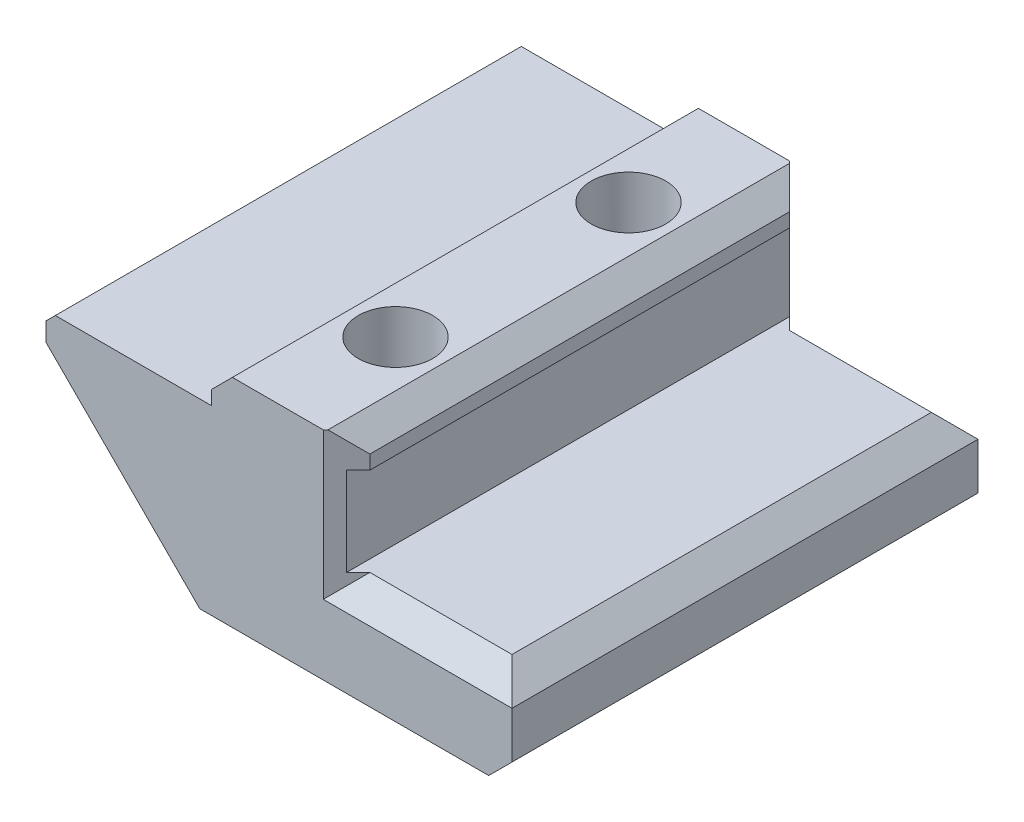
from build123d import *

# Parameters (mm, degrees)
SKETCH_1_W          = 20
SKETCH_1_H          = 20
EXTRUDE_1_DEPTH     = 4
SKETCH_2_W          = 12.9
SKETCH_2_H          = 20
EXTRUDE_2_DEPTH     = 3.8
SKETCH_3_R          = 1.6
CUT_EXTRUDE_1_DEPTH = 30.340074983
SKETCH_4_W          = 5.8
SKETCH_4_H          = 20
SKETCH_4_R          = 1.6
EXTRUDE_3_DEPTH     = 1.5
SKETCH_5_R          = 3
CUT_EXTRUDE_3_DEPTH = 2.4
CHAMFER_3_SIZE      = 1.5
CHAMFER_1_SIZE      = 6.6
CHAMFER_2_SIZE      = 1
CHAMFER_4_SIZE      = 0.4
CHAMFER_5_SIZE      = 0.9
SKETCH_7_W          = 21.061561739
SKETCH_7_H          = 3.8
CUT_EXTRUDE_6_DEPTH = 0.5


with BuildPart() as part:
    # 草图1 → 凸台-拉伸1 (new body)
    with BuildSketch(Plane(origin=(0, 0, 0), x_dir=(1, 0, 0), z_dir=(0, 1, 0))):
        with Locations((10, 10)):
            Rectangle(SKETCH_1_W, SKETCH_1_H)
    extrude(amount=EXTRUDE_1_DEPTH)

    # 草图2 → 凸台-拉伸2 (add)
    with BuildSketch(Plane(origin=(0, 4, 0), x_dir=(1, 0, 0), z_dir=(0, 1, 0))):
        with Locations((6.45, 10)):
            Rectangle(SKETCH_2_W, SKETCH_2_H)
    extrude(amount=EXTRUDE_2_DEPTH)

    # 草图3 → 切除-拉伸1 (cut, through all)
    with BuildSketch(Plane(origin=(0, 0, 0), x_dir=(-1, 0, 0), z_dir=(0, -1, 0))):
        with Locations(Location((-10, 5, 0), (0, 0, 90))):
            Circle(SKETCH_3_R)
        with Locations(Location((-10, 15, 0), (0, 0, 90))):
            Circle(SKETCH_3_R)
    extrude(amount=-CUT_EXTRUDE_1_DEPTH, mode=Mode.SUBTRACT)

    # 草图4 → 凸台-拉伸3 (add)
    with BuildSketch(Plane(origin=(0, 7.8, 0), x_dir=(1, 0, 0), z_dir=(0, 1, 0))):
        with Locations((10, 10)):
            Rectangle(SKETCH_4_W, SKETCH_4_H)
        with Locations(Location((10, 15, 0), (0, 0, 90))):
            Circle(SKETCH_4_R, mode=Mode.SUBTRACT)
        with Locations(Location((10, 5, 0), (0, 0, 90))):
            Circle(SKETCH_4_R, mode=Mode.SUBTRACT)
    extrude(amount=EXTRUDE_3_DEPTH)

    # 草图5 → 切除-拉伸3 (cut)
    with BuildSketch(Plane(origin=(0, 0, 0), x_dir=(-1, 0, 0), z_dir=(0, -1, 0))):
        with Locations(Location((-10, 5, 0), (0, 0, 90))):
            Circle(SKETCH_5_R)
        with Locations(Location((-10, 15, 0), (0, 0, 90))):
            Circle(SKETCH_5_R)
    extrude(amount=-CUT_EXTRUDE_3_DEPTH, mode=Mode.SUBTRACT)

    # 倒角3
    # the kernel refuses this chamfer: 1.5 mm, written as the material it takes off along each edge
    with BuildSketch(Plane(origin=(10, 2.4, -15), x_dir=(0, 0, -1), z_dir=(-1, 0, 0))) as chamfer_3_piece_1_section:
        Polygon((1.6 + CHAMFER_3_SIZE, 0), (1.6, -CHAMFER_3_SIZE), (1.6, 0), align=None)
    chamfer_3_piece_1 = revolve(axis=Axis((10, 2.4, -15), (0, -1, 0)), mode=Mode.PRIVATE)
    chamfer_3_piece_1 = chamfer_3_piece_1 & Plane(origin=(10, 2.4, -15), x_dir=(0, 0, -1), z_dir=(0, -1, 0)) * Cylinder(3, 13, mode=Mode.PRIVATE)
    add(chamfer_3_piece_1, mode=Mode.SUBTRACT)
    with BuildSketch(Plane(origin=(10, 2.4, -5), x_dir=(0, 0, -1), z_dir=(-1, 0, 0))) as chamfer_3_piece_2_section:
        Polygon((1.6 + CHAMFER_3_SIZE, 0), (1.6, -CHAMFER_3_SIZE), (1.6, 0), align=None)
    chamfer_3_piece_2 = revolve(axis=Axis((10, 2.4, -5), (0, -1, 0)), mode=Mode.PRIVATE)
    chamfer_3_piece_2 = chamfer_3_piece_2 & Plane(origin=(10, 2.4, -5), x_dir=(0, 0, -1), z_dir=(0, -1, 0)) * Cylinder(3, 13, mode=Mode.PRIVATE)
    add(chamfer_3_piece_2, mode=Mode.SUBTRACT)

    # 倒角1
    chamfer_1_edges = [part.edges().sort_by_distance(p)[0] for p in [
        (0, 0, -10),
    ]]
    chamfer(chamfer_1_edges, length=CHAMFER_1_SIZE)

    # 倒角2
    chamfer_2_edges = [part.edges().sort_by_distance(p)[0] for p in [
        (20, 4, -10),
        (16.45, 4, 0),
        (12.9, 6.65, 0),
        (12.9, 6.65, -20),
        (16.45, 4, -20),
        (20, 0, -10),
    ]]
    chamfer(chamfer_2_edges, length=CHAMFER_2_SIZE)

    # 倒角4
    chamfer_4_edges = [part.edges().sort_by_distance(p)[0] for p in [
        (0, 7.8, -10),
    ]]
    chamfer(chamfer_4_edges, length=CHAMFER_4_SIZE)

    # 倒角5
    chamfer_5_edges = [part.edges().sort_by_distance(p)[0] for p in [
        (7.1, 9.3, -10),
        (12.9, 9.3, -10),
    ]]
    chamfer(chamfer_5_edges, length=CHAMFER_5_SIZE)

    # 草图7 → 切除-拉伸6 (cut)
    with BuildSketch(Plane(origin=(12.9, 0, 0), x_dir=(0, 0, -1), z_dir=(1, 0, 0))):
        with Locations((9.469219131, 5.9)):
            Rectangle(SKETCH_7_W, SKETCH_7_H)
    extrude(amount=-CUT_EXTRUDE_6_DEPTH, mode=Mode.SUBTRACT)


solid = part.part
